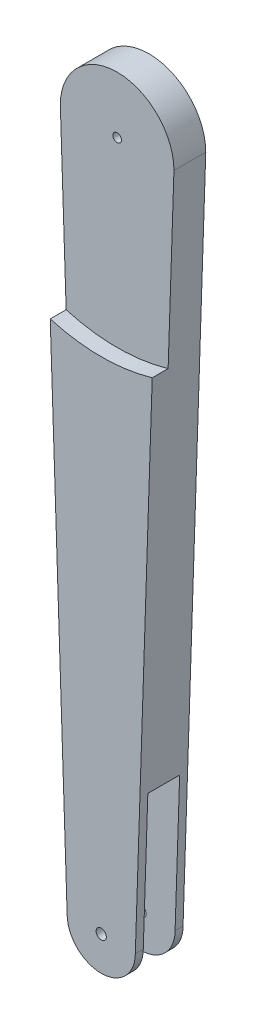
from build123d import *

# Parameters (mm, degrees)
BOSS_EXTRUDE1_DEPTH = 21
SKETCH3_R           = 80
CUT_EXTRUDE1_DEPTH  = 7
SKETCH4_R           = 1.9
CUT_EXTRUDE2_DEPTH  = 22.5
SKETCH5_W           = 14
SKETCH5_H           = 75.877957393
CUT_EXTRUDE3_DEPTH  = 109
SKETCH6_R           = 2.25
CUT_EXTRUDE4_DEPTH  = 22


with BuildPart() as part:
    # Sketch2 → Boss-Extrude1 (new body)
    with BuildSketch(Plane.XY):
        with BuildLine():
            ThreePointArc((0, -315), (10.606601718, -310.606601718), (15, -300))
            Line((15, -300), (25, 0))
            ThreePointArc((25, 0), (0, 25), (-25, 0))
            Line((-25, 0), (-15, -300))
            ThreePointArc((-15, -300), (-10.606601718, -310.606601718), (0, -315))
        make_face()
    extrude(amount=BOSS_EXTRUDE1_DEPTH)

    # Sketch3 → Cut-Extrude1 (cut)
    with BuildSketch(Plane.XY.offset(21)):
        Circle(SKETCH3_R)
    extrude(amount=-CUT_EXTRUDE1_DEPTH, mode=Mode.SUBTRACT)

    # Sketch4 → Cut-Extrude2 (cut)
    with BuildSketch(Plane.XY.offset(14)):
        Circle(SKETCH4_R)
    extrude(amount=-CUT_EXTRUDE2_DEPTH, mode=Mode.SUBTRACT)

    # Sketch5 → Cut-Extrude3 (cut, symmetric)
    with BuildSketch(Plane(origin=(24.972253052, -0.832408435, 0), x_dir=(0, 0, -1), z_dir=(0.9994449069791543, -0.033314830232638495, 0))):
        with Locations((-10.5, -276.894493398)):
            Rectangle(SKETCH5_W, SKETCH5_H)
    extrude(amount=CUT_EXTRUDE3_DEPTH, both=True, mode=Mode.SUBTRACT)

    # Sketch6 → Cut-Extrude4 (cut)
    with BuildSketch(Plane.XY.offset(21)):
        with Locations((0, -300)):
            Circle(SKETCH6_R)
    extrude(amount=-CUT_EXTRUDE4_DEPTH, mode=Mode.SUBTRACT)


solid = part.part
